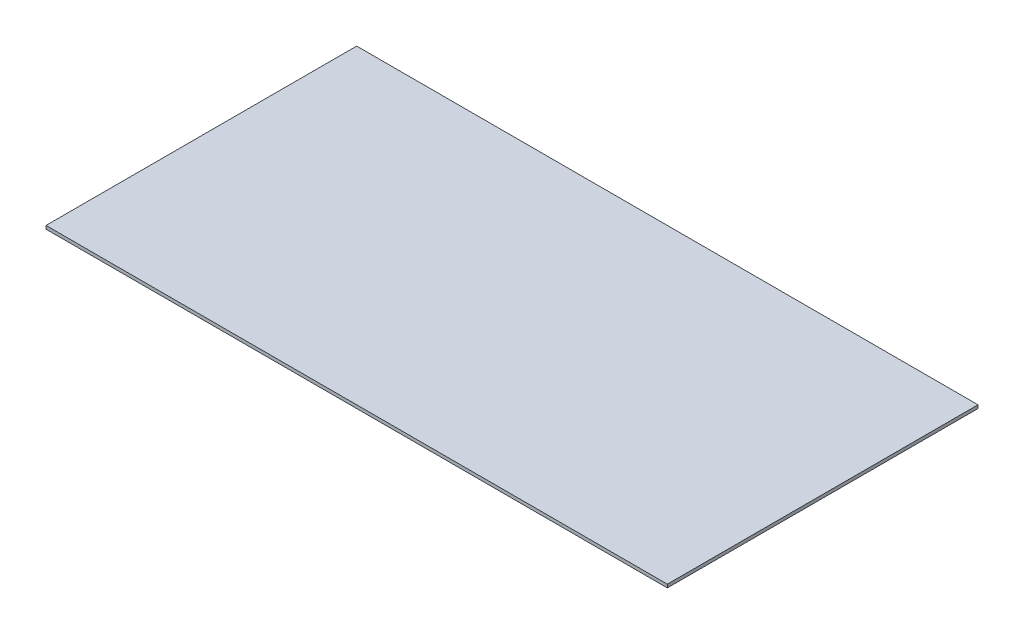
from build123d import *

# Parameters (mm, degrees)
SKETCH1_W           = 482.6
SKETCH1_H           = 241.3
BOSS_EXTRUDE1_DEPTH = 2.54


with BuildPart() as part:
    # Sketch1 → Boss-Extrude1 (new body)
    with BuildSketch(Plane(origin=(0, 0, 0), x_dir=(1, 0, 0), z_dir=(0, 1, 0))):
        Rectangle(SKETCH1_W, SKETCH1_H)
    extrude(amount=BOSS_EXTRUDE1_DEPTH)


solid = part.part
